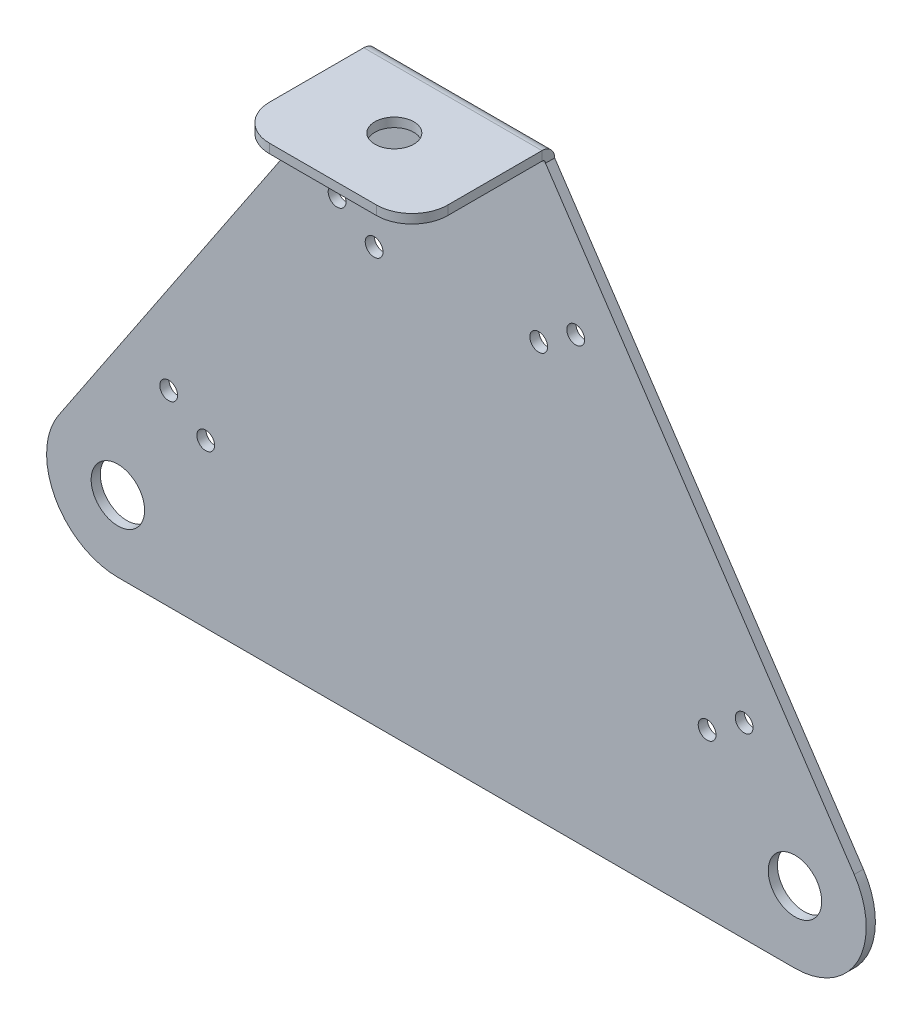
from build123d import *

# Parameters (mm, degrees)
SKETCH_S_R                 = 9.525
BASE_FLANGE1_DEPTH         = 3.2639
F_1_4_0_2500_DOWEL_HOLE2_D = 6.35
EDGE_FLANGE1_DEPTH         = 63.5
F_1_2_CLEARANCE_HOLE1_D    = 13.89126
FILLET1_R                  = 12.7


# Sheet-metal steps are written as plain solids
with BuildPart() as part:
    # s → Base-Flange1 (new body)
    with BuildSketch(Plane.XY):
        with BuildLine():
            Line((31.75, -30.356048), (-31.75, -30.356048))
            Line((-31.75, -30.356048), (-141.763337817, -194.851484961))
            ThreePointArc((-141.763337817, -194.851484961), (-143.053340178, -220.94065371), (-120.65, -234.371929933))
            Line((-120.65, -234.371929933), (120.65, -234.371929933))
            ThreePointArc((120.65, -234.371929933), (143.053340178, -220.94065371), (141.763337817, -194.851484961))
            Line((141.763337817, -194.851484961), (31.75, -30.356048))
        make_face()
        with Locations((-120.65, -208.971929933)):
            Circle(SKETCH_S_R, mode=Mode.SUBTRACT)
        with Locations((120.65, -208.971929933)):
            Circle(SKETCH_S_R, mode=Mode.SUBTRACT)
    extrude(amount=-BASE_FLANGE1_DEPTH)

    # 1/4 (0.2500) Dowel Hole2 (through all)
    with Locations(Plane.XY):
        with Locations((-102.537139367, -167.610949699), (-89.341303231, -176.436227806), (-42.525248236, -77.879263975), (-29.3294121, -86.704542082), (29.3294121, -86.704542082), (42.525248236, -77.879263975), (89.341303231, -176.436227806), (102.537139367, -167.610949699)):
            Hole(F_1_4_0_2500_DOWEL_HOLE2_D / 2)

    # Edge-Flange1 section (across the edge) → Edge-Flange1 (add)
    with BuildSketch(Plane(origin=(31.75, -29.086048, 0), x_dir=(0, -1, 0), z_dir=(-1, 0, 0))):
        with BuildLine():
            Line((-3.2639, 1.27), (-3.2639, 47.5361))
            Line((-3.2639, 47.5361), (0, 47.5361))
            Line((0, 47.5361), (0, 1.27))
            ThreePointArc((0, 1.27), (0.371974388, 0.371974388), (1.27, 0))
            Line((1.27, 0), (1.27, -3.2639))
            ThreePointArc((1.27, -3.2639), (-1.935951435, -1.935951435), (-3.2639, 1.27))
        make_face()
    extrude(amount=EDGE_FLANGE1_DEPTH)

    # 1/2 Clearance Hole1 (through all)
    with Locations(Plane(origin=(0, -25.822148, 0), x_dir=(1, 0, 0), z_dir=(0, 1, 0))):
        with Locations((0, -22.1361)):
            Hole(F_1_2_CLEARANCE_HOLE1_D / 2)

    # Fillet1
    fillet1_edges = [part.edges().sort_by_distance(p)[0] for p in [
        (31.75, -27.454098, 47.5361),
        (-31.75, -27.454098, 47.5361),
    ]]
    fillet(fillet1_edges, radius=FILLET1_R)


solid = part.part
